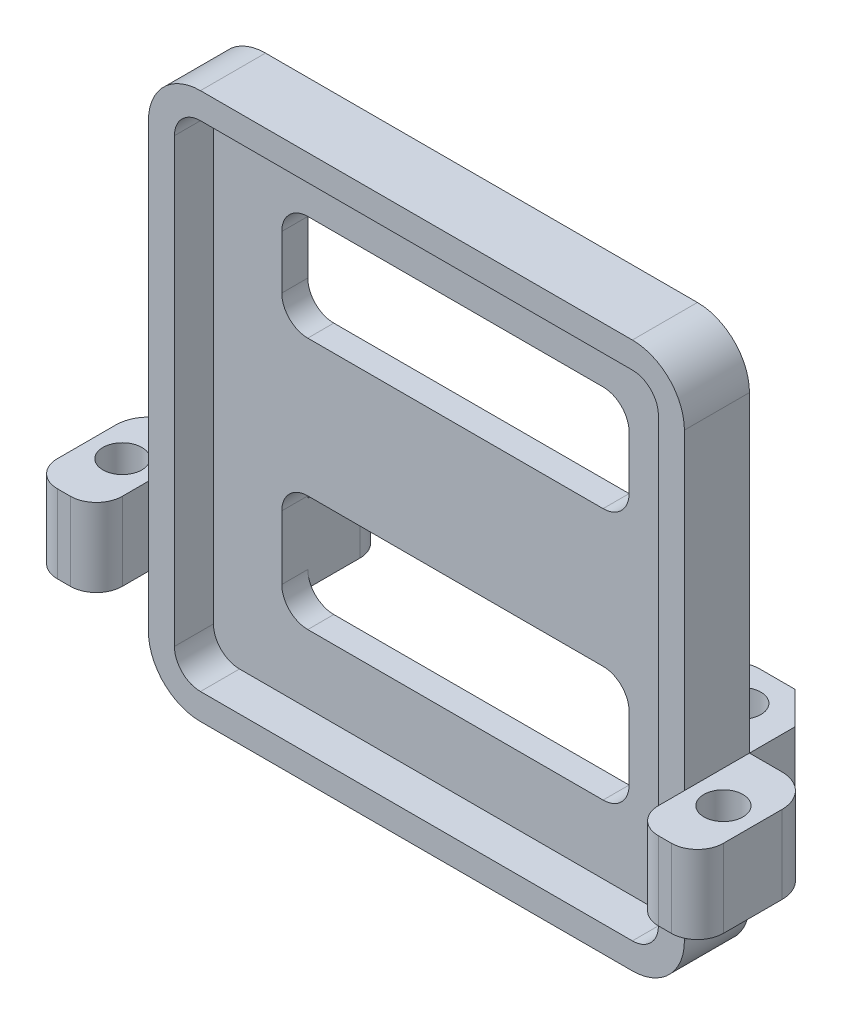
from build123d import *

# Parameters (mm, degrees)
SKETCH1_W           = 41.2
SKETCH1_H           = 42
BOSS_EXTRUDE1_DEPTH = 5
CUT_EXTRUDE1_DEPTH  = 3
FILLET1_R           = 4
CUT_EXTRUDE2_DEPTH  = 2
SKETCH6_W           = 5
SKETCH6_H           = 6
BOSS_EXTRUDE2_DEPTH = 5
SKETCH7_W           = 5
SKETCH7_H           = 6
BOSS_EXTRUDE3_DEPTH = 5
SKETCH8_W           = 7.25
SKETCH8_H           = 6
BOSS_EXTRUDE4_DEPTH = 6
SKETCH9_W           = 7.25
SKETCH9_H           = 6
BOSS_EXTRUDE5_DEPTH = 6
SKETCH13_W          = 5
SKETCH13_H          = 6
BOSS_EXTRUDE6_DEPTH = 4
SKETCH10_R          = 1.5
CUT_EXTRUDE3_DEPTH  = 6
SKETCH12_R          = 1.5
CUT_EXTRUDE4_DEPTH  = 6
FILLET3_R           = 2
FILLET4_R           = 2.5
FILLET6_R           = 2
CUT_EXTRUDE6_START  = -6
CUT_EXTRUDE6_DEPTH  = 6
CUT_EXTRUDE7_START  = -6
CUT_EXTRUDE7_DEPTH  = 6


# Read off the part's stored shape, not the designer's step: Cut-Extrude6, Cut-Extrude7
with BuildPart() as part:
    # Sketch1 → Boss-Extrude1 (new body)
    with BuildSketch(Plane.XY):
        with Locations((20.6, -21)):
            Rectangle(SKETCH1_W, SKETCH1_H)
    extrude(amount=BOSS_EXTRUDE1_DEPTH)

    # Sketch2 → Cut-Extrude1 (cut)
    with BuildSketch(Plane.XY.offset(5)):
        with BuildLine():
            Line((4, -2), (37.2, -2))
            ThreePointArc((37.2, -2), (38.614213562, -2.585786438), (39.2, -4))
            Line((39.2, -4), (39.2, -38))
            ThreePointArc((39.2, -38), (38.614213562, -39.414213562), (37.2, -40))
            Line((37.2, -40), (4, -40))
            ThreePointArc((4, -40), (2.585786438, -39.414213562), (2, -38))
            Line((2, -38), (2, -4))
            ThreePointArc((2, -4), (2.585786438, -2.585786438), (4, -2))
        make_face()
    extrude(amount=-CUT_EXTRUDE1_DEPTH, mode=Mode.SUBTRACT)

    # Fillet1
    fillet1_edges = [part.edges().sort_by_distance(p)[0] for p in [
        (0, 0, 2.5),
        (41.2, 0, 2.5),
        (41.2, -42, 2.5),
        (0, -42, 2.5),
    ]]
    fillet(fillet1_edges, radius=FILLET1_R)

    # Sketch3 → Cut-Extrude2 (cut)
    with BuildSketch(Plane.XY.offset(2)):
        with BuildLine():
            Line((9.25, -7.25), (31.95, -7.25))
            ThreePointArc((31.95, -7.25), (33.364213562, -7.835786438), (33.95, -9.25))
            Line((33.95, -9.25), (33.95, -13.35))
            ThreePointArc((33.95, -13.35), (33.364213562, -14.764213562), (31.95, -15.35))
            Line((31.95, -15.35), (9.25, -15.35))
            ThreePointArc((9.25, -15.35), (7.835786438, -14.764213562), (7.25, -13.35))
            Line((7.25, -13.35), (7.25, -9.25))
            ThreePointArc((7.25, -9.25), (7.835786438, -7.835786438), (9.25, -7.25))
        make_face()
        with BuildLine():
            Line((9.25, -25.85), (31.95, -25.85))
            ThreePointArc((31.95, -25.85), (33.364213562, -26.435786438), (33.95, -27.85))
            Line((33.95, -27.85), (33.95, -32.75))
            ThreePointArc((33.95, -32.75), (33.364213562, -34.164213562), (31.95, -34.75))
            Line((31.95, -34.75), (9.25, -34.75))
            ThreePointArc((9.25, -34.75), (7.835786438, -34.164213562), (7.25, -32.75))
            Line((7.25, -32.75), (7.25, -27.85))
            ThreePointArc((7.25, -27.85), (7.835786438, -26.435786438), (9.25, -25.85))
        make_face()
    extrude(amount=-CUT_EXTRUDE2_DEPTH, mode=Mode.SUBTRACT)

    # Sketch6 → Boss-Extrude2 (add)
    with BuildSketch(Plane(origin=(41.2, 0, 0), x_dir=(0, 0, -1), z_dir=(1, 0, 0))):
        with Locations((-2.5, -31)):
            Rectangle(SKETCH6_W, SKETCH6_H)
    extrude(amount=BOSS_EXTRUDE2_DEPTH)

    # Sketch7 → Boss-Extrude3 (add)
    with BuildSketch(Plane.ZY):
        with Locations((2.5, -31)):
            Rectangle(SKETCH7_W, SKETCH7_H)
    extrude(amount=BOSS_EXTRUDE3_DEPTH)

    # Sketch8 → Boss-Extrude4 (add)
    with BuildSketch(Plane(origin=(0, 0, 0), x_dir=(-1, 0, 0), z_dir=(0, 0, -1))):
        with Locations((-37.575, -31)):
            Rectangle(SKETCH8_W, SKETCH8_H)
    extrude(amount=BOSS_EXTRUDE4_DEPTH)

    # Sketch9 → Boss-Extrude5 (add)
    with BuildSketch(Plane(origin=(0, 0, 0), x_dir=(-1, 0, 0), z_dir=(0, 0, -1))):
        with Locations((-3.625, -31)):
            Rectangle(SKETCH9_W, SKETCH9_H)
    extrude(amount=BOSS_EXTRUDE5_DEPTH)

    # Sketch13 → Boss-Extrude6 (add)
    with BuildSketch(Plane.XY.offset(5)):
        with Locations((43.7, -31)):
            Rectangle(SKETCH13_W, SKETCH13_H)
        with Locations((-2.5, -31)):
            Rectangle(SKETCH13_W, SKETCH13_H)
    extrude(amount=BOSS_EXTRUDE6_DEPTH)

    # Sketch10 → Cut-Extrude3 (cut)
    with BuildSketch(Plane(origin=(0, -28, 0), x_dir=(1, 0, 0), z_dir=(0, 1, 0))):
        with Locations(Location((43.7, -4.5, 0), (0, 0, 180))):
            Circle(SKETCH10_R)
    cut_extrude3 = extrude(amount=-CUT_EXTRUDE3_DEPTH, mode=Mode.SUBTRACT)

    # Mirror1: Cut-Extrude3 across plane
    add(cut_extrude3.mirror(Plane(origin=(20.6, 0, 0), x_dir=(0, 0, 1), z_dir=(1, 0, 0))), mode=Mode.SUBTRACT)

    # Sketch12 → Cut-Extrude4 (cut)
    with BuildSketch(Plane(origin=(0, -28, 0), x_dir=(1, 0, 0), z_dir=(0, 1, 0))):
        with Locations(Location((37.575, 3, 0), (0, 0, 270))):
            Circle(SKETCH12_R)
    cut_extrude4 = extrude(amount=-CUT_EXTRUDE4_DEPTH, mode=Mode.SUBTRACT)

    # Mirror2: Cut-Extrude4 across plane
    add(cut_extrude4.mirror(Plane(origin=(20.6, 0, 0), x_dir=(0, 0, 1), z_dir=(1, 0, 0))), mode=Mode.SUBTRACT)

    # Fillet3
    fillet3_edges = [part.edges().sort_by_distance(p)[0] for p in [
        (33.95, -31, -6),
        (7.25, -31, -6),
    ]]
    fillet(fillet3_edges, radius=FILLET3_R)

    # Fillet4
    fillet4_edges = [part.edges().sort_by_distance(p)[0] for p in [
        (46.2, -31, 0),
        (-5, -31, 0),
    ]]
    fillet(fillet4_edges, radius=FILLET4_R)

    # Fillet6
    fillet6_edges = [part.edges().sort_by_distance(p)[0] for p in [
        (46.2, -31, 9),
        (41.2, -31, 9),
        (0, -31, 9),
        (-5, -31, 9),
    ]]
    fillet(fillet6_edges, radius=FILLET6_R)

    # Cut-Extrude6 outline → Cut-Extrude6 (cut)
    with BuildSketch(Plane(origin=(0, -28, 0), x_dir=(1, 0, 0), z_dir=(0, 1, 0)).offset(CUT_EXTRUDE6_START)):
        Polygon((41.2, 6), (38.7, 6), (41.2, 3.5), align=None)
    extrude(amount=CUT_EXTRUDE6_DEPTH, mode=Mode.SUBTRACT)

    # Cut-Extrude7 outline → Cut-Extrude7 (cut)
    with BuildSketch(Plane(origin=(0, -28, 0), x_dir=(1, 0, 0), z_dir=(0, 1, 0)).offset(CUT_EXTRUDE7_START)):
        Polygon((0, 6), (0, 3.5), (2.5, 6), align=None)
    extrude(amount=CUT_EXTRUDE7_DEPTH, mode=Mode.SUBTRACT)


solid = part.part
